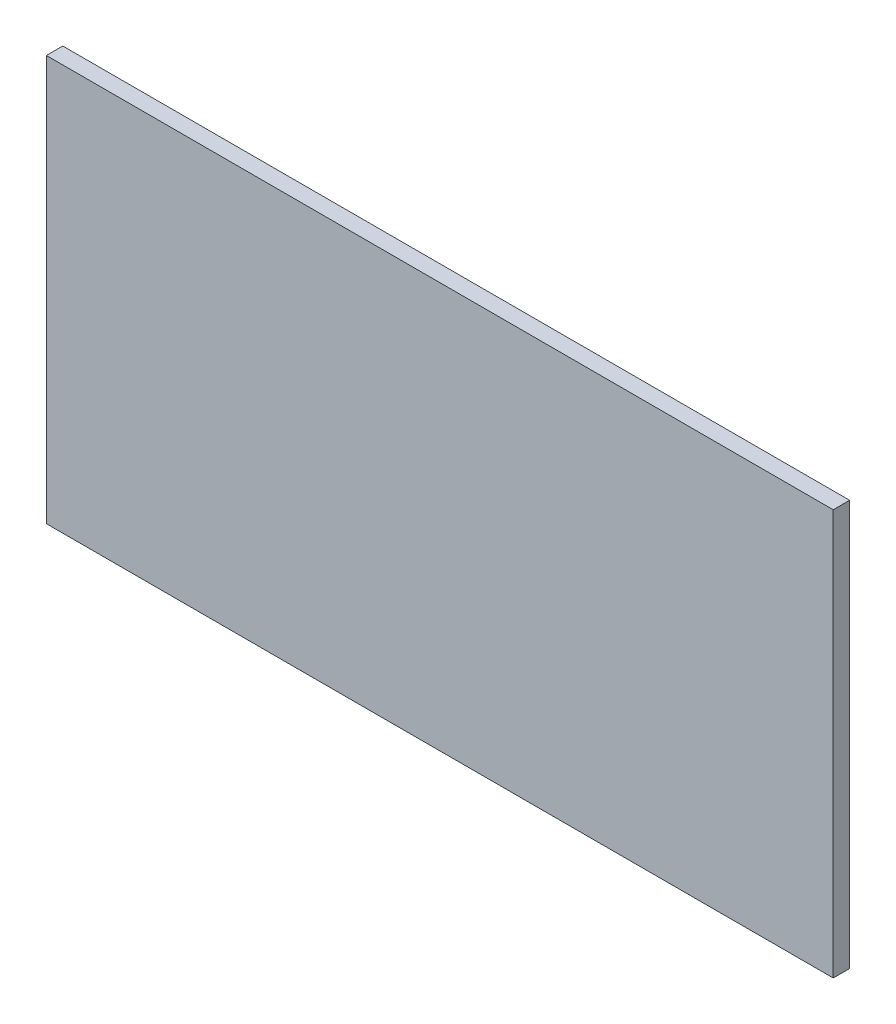
from build123d import *

# Parameters (mm, degrees)
SKETCH1_W           = 609.6
SKETCH1_H           = 314.180648672
BOSS_EXTRUDE1_DEPTH = 12.7


with BuildPart() as part:
    # Sketch1 → Boss-Extrude1 (new body)
    with BuildSketch(Plane.XY):
        Rectangle(SKETCH1_W, SKETCH1_H)
    extrude(amount=-BOSS_EXTRUDE1_DEPTH)

    # Loft1: read off the stored shape, not the designer's step
    # Loft1: loft between two sections, ruled curve by curve
    loft1_from = [
        Edge.make_bspline([(304.8, 157.090324336, -12.7), (304.8, 143.999463975, -12.7), (304.8, 130.908603613, -12.7), (304.8, 104.726882891, -12.7), (304.8, 91.636022529, -12.7), (304.8, 65.454301807, -12.7), (304.8, 52.363441445, -12.7), (304.8, 26.181720723, -12.7), (304.8, 13.090860361, -12.7), (304.8, -13.090860361, -12.7), (304.8, -26.181720723, -12.7), (304.8, -52.363441445, -12.7), (304.8, -65.454301807, -12.7), (304.8, -91.636022529, -12.7), (304.8, -104.726882891, -12.7), (304.8, -130.908603613, -12.7), (304.8, -143.999463975, -12.7), (304.8, -157.090324336, -12.7)], [0, 0, 0, 0, 0.125, 0.125, 0.25, 0.25, 0.375, 0.375, 0.5, 0.5, 0.625, 0.625, 0.75, 0.75, 0.875, 0.875, 1, 1, 1, 1], 3),
        Edge.make_bspline([(304.8, -157.090324336, -12.7), (292.1, -157.090324336, -12.7), (279.4, -157.090324336, -12.7), (254, -157.090324336, -12.7), (241.3, -157.090324336, -12.7), (215.9, -157.090324336, -12.7), (203.2, -157.090324336, -12.7), (177.8, -157.090324336, -12.7), (165.1, -157.090324336, -12.7), (139.7, -157.090324336, -12.7), (127, -157.090324336, -12.7), (101.6, -157.090324336, -12.7), (88.9, -157.090324336, -12.7), (63.5, -157.090324336, -12.7), (50.8, -157.090324336, -12.7), (25.4, -157.090324336, -12.7), (12.7, -157.090324336, -12.7), (-12.7, -157.090324336, -12.7), (-25.4, -157.090324336, -12.7), (-50.8, -157.090324336, -12.7), (-63.5, -157.090324336, -12.7), (-88.9, -157.090324336, -12.7), (-101.6, -157.090324336, -12.7), (-127, -157.090324336, -12.7), (-139.7, -157.090324336, -12.7), (-165.1, -157.090324336, -12.7), (-177.8, -157.090324336, -12.7), (-203.2, -157.090324336, -12.7), (-215.9, -157.090324336, -12.7), (-241.3, -157.090324336, -12.7), (-254, -157.090324336, -12.7), (-279.4, -157.090324336, -12.7), (-292.1, -157.090324336, -12.7), (-304.8, -157.090324336, -12.7)], [0, 0, 0, 0, 0.0625, 0.0625, 0.125, 0.125, 0.1875, 0.1875, 0.25, 0.25, 0.3125, 0.3125, 0.375, 0.375, 0.4375, 0.4375, 0.5, 0.5, 0.5625, 0.5625, 0.625, 0.625, 0.6875, 0.6875, 0.75, 0.75, 0.8125, 0.8125, 0.875, 0.875, 0.9375, 0.9375, 1, 1, 1, 1], 3),
        Edge.make_bspline([(-304.8, 157.090324336, -12.7), (-292.1, 157.090324336, -12.7), (-279.4, 157.090324336, -12.7), (-254, 157.090324336, -12.7), (-241.3, 157.090324336, -12.7), (-215.9, 157.090324336, -12.7), (-203.2, 157.090324336, -12.7), (-177.8, 157.090324336, -12.7), (-165.1, 157.090324336, -12.7), (-139.7, 157.090324336, -12.7), (-127, 157.090324336, -12.7), (-101.6, 157.090324336, -12.7), (-88.9, 157.090324336, -12.7), (-63.5, 157.090324336, -12.7), (-50.8, 157.090324336, -12.7), (-25.4, 157.090324336, -12.7), (-12.7, 157.090324336, -12.7), (12.7, 157.090324336, -12.7), (25.4, 157.090324336, -12.7), (50.8, 157.090324336, -12.7), (63.5, 157.090324336, -12.7), (88.9, 157.090324336, -12.7), (101.6, 157.090324336, -12.7), (127, 157.090324336, -12.7), (139.7, 157.090324336, -12.7), (165.1, 157.090324336, -12.7), (177.8, 157.090324336, -12.7), (203.2, 157.090324336, -12.7), (215.9, 157.090324336, -12.7), (241.3, 157.090324336, -12.7), (254, 157.090324336, -12.7), (279.4, 157.090324336, -12.7), (292.1, 157.090324336, -12.7), (304.8, 157.090324336, -12.7)], [0, 0, 0, 0, 0.0625, 0.0625, 0.125, 0.125, 0.1875, 0.1875, 0.25, 0.25, 0.3125, 0.3125, 0.375, 0.375, 0.4375, 0.4375, 0.5, 0.5, 0.5625, 0.5625, 0.625, 0.625, 0.6875, 0.6875, 0.75, 0.75, 0.8125, 0.8125, 0.875, 0.875, 0.9375, 0.9375, 1, 1, 1, 1], 3),
        Edge.make_bspline([(-304.8, -157.090324336, -12.7), (-304.8, -143.999463975, -12.7), (-304.8, -130.908603613, -12.7), (-304.8, -104.726882891, -12.7), (-304.8, -91.636022529, -12.7), (-304.8, -65.454301807, -12.7), (-304.8, -52.363441445, -12.7), (-304.8, -26.181720723, -12.7), (-304.8, -13.090860361, -12.7), (-304.8, 13.090860361, -12.7), (-304.8, 26.181720723, -12.7), (-304.8, 52.363441445, -12.7), (-304.8, 65.454301807, -12.7), (-304.8, 91.636022529, -12.7), (-304.8, 104.726882891, -12.7), (-304.8, 130.908603613, -12.7), (-304.8, 143.999463975, -12.7), (-304.8, 157.090324336, -12.7)], [0, 0, 0, 0, 0.125, 0.125, 0.25, 0.25, 0.375, 0.375, 0.5, 0.5, 0.625, 0.625, 0.75, 0.75, 0.875, 0.875, 1, 1, 1, 1], 3),
    ]
    loft1_to = [
        Edge.make_bspline([(79.022222222, 40.727121124, -38.1), (80.577057613, 37.710297337, -38.1), (81.980389053, 34.561909453, -38.1), (84.430287104, 28.050604162, -38.1), (85.476699573, 24.687769705, -38.1), (87.169677239, 17.810095816, -38.1), (87.816120347, 14.295394928, -38.1), (88.681315551, 7.187042588, -38.1), (88.9, 3.593569511, -38.1), (88.9, -3.593569511, -38.1), (88.681315551, -7.187042588, -38.1), (87.816120347, -14.295394928, -38.1), (87.169677239, -17.810095816, -38.1), (85.476699573, -24.687769705, -38.1), (84.430287104, -28.050604162, -38.1), (81.980389053, -34.561909453, -38.1), (80.577057613, -37.710297337, -38.1), (79.022222222, -40.727121124, -38.1)], [0, 0, 0, 0, 0.125, 0.125, 0.25, 0.25, 0.375, 0.375, 0.5, 0.5, 0.625, 0.625, 0.75, 0.75, 0.875, 0.875, 1, 1, 1, 1], 3),
        Edge.make_bspline([(79.022222222, -40.727121124, -38.1), (77.513810329, -43.653870095, -38.1), (75.79123489, -46.596780367, -38.1), (71.874617054, -52.43672997, -38.1), (69.680294943, -55.333709982, -38.1), (64.792903277, -60.983954027, -38.1), (62.099546472, -63.737031565, -38.1), (56.211815103, -68.985467365, -38.1), (53.017211054, -71.480494923, -38.1), (46.157754062, -76.090390736, -38.1), (42.492809932, -78.204805568, -38.1), (34.761608604, -81.934492597, -38.1), (30.695467957, -83.549260467, -38.1), (22.268836934, -86.178823265, -38.1), (17.908694381, -87.193176196, -38.1), (9.032113746, -88.553894498, -38.1), (4.516207395, -88.9, -38.1), (-4.516207395, -88.9, -38.1), (-9.032113746, -88.553894498, -38.1), (-17.908694381, -87.193176196, -38.1), (-22.268836934, -86.178823265, -38.1), (-30.695467957, -83.549260467, -38.1), (-34.761608604, -81.934492597, -38.1), (-42.492809932, -78.204805568, -38.1), (-46.157754062, -76.090390736, -38.1), (-53.017211054, -71.480494923, -38.1), (-56.211815103, -68.985467365, -38.1), (-62.099546472, -63.737031565, -38.1), (-64.792903277, -60.983954027, -38.1), (-69.680294943, -55.333709982, -38.1), (-71.874617054, -52.43672997, -38.1), (-75.79123489, -46.596780367, -38.1), (-77.513810329, -43.653870095, -38.1), (-79.022222222, -40.727121124, -38.1)], [0, 0, 0, 0, 0.0625, 0.0625, 0.125, 0.125, 0.1875, 0.1875, 0.25, 0.25, 0.3125, 0.3125, 0.375, 0.375, 0.4375, 0.4375, 0.5, 0.5, 0.5625, 0.5625, 0.625, 0.625, 0.6875, 0.6875, 0.75, 0.75, 0.8125, 0.8125, 0.875, 0.875, 0.9375, 0.9375, 1, 1, 1, 1], 3),
        Edge.make_bspline([(-79.022222222, 40.727121124, -38.1), (-77.513810329, 43.653870095, -38.1), (-75.79123489, 46.596780367, -38.1), (-71.874617054, 52.43672997, -38.1), (-69.680294943, 55.333709982, -38.1), (-64.792903277, 60.983954027, -38.1), (-62.099546472, 63.737031565, -38.1), (-56.211815103, 68.985467365, -38.1), (-53.017211054, 71.480494923, -38.1), (-46.157754062, 76.090390736, -38.1), (-42.492809932, 78.204805568, -38.1), (-34.761608604, 81.934492597, -38.1), (-30.695467957, 83.549260467, -38.1), (-22.268836934, 86.178823265, -38.1), (-17.908694381, 87.193176196, -38.1), (-9.032113746, 88.553894498, -38.1), (-4.516207395, 88.9, -38.1), (4.516207395, 88.9, -38.1), (9.032113746, 88.553894498, -38.1), (17.908694381, 87.193176196, -38.1), (22.268836934, 86.178823265, -38.1), (30.695467957, 83.549260467, -38.1), (34.761608604, 81.934492597, -38.1), (42.492809932, 78.204805568, -38.1), (46.157754062, 76.090390736, -38.1), (53.017211054, 71.480494923, -38.1), (56.211815103, 68.985467365, -38.1), (62.099546472, 63.737031565, -38.1), (64.792903277, 60.983954027, -38.1), (69.680294943, 55.333709982, -38.1), (71.874617054, 52.43672997, -38.1), (75.79123489, 46.596780367, -38.1), (77.513810329, 43.653870095, -38.1), (79.022222222, 40.727121124, -38.1)], [0, 0, 0, 0, 0.0625, 0.0625, 0.125, 0.125, 0.1875, 0.1875, 0.25, 0.25, 0.3125, 0.3125, 0.375, 0.375, 0.4375, 0.4375, 0.5, 0.5, 0.5625, 0.5625, 0.625, 0.625, 0.6875, 0.6875, 0.75, 0.75, 0.8125, 0.8125, 0.875, 0.875, 0.9375, 0.9375, 1, 1, 1, 1], 3),
        Edge.make_bspline([(-79.022222222, -40.727121124, -38.1), (-80.577057613, -37.710297337, -38.1), (-81.980389053, -34.561909453, -38.1), (-84.430287104, -28.050604162, -38.1), (-85.476699573, -24.687769705, -38.1), (-87.169677239, -17.810095816, -38.1), (-87.816120347, -14.295394928, -38.1), (-88.681315551, -7.187042588, -38.1), (-88.9, -3.593569511, -38.1), (-88.9, 3.593569511, -38.1), (-88.681315551, 7.187042588, -38.1), (-87.816120347, 14.295394928, -38.1), (-87.169677239, 17.810095816, -38.1), (-85.476699573, 24.687769705, -38.1), (-84.430287104, 28.050604162, -38.1), (-81.980389053, 34.561909453, -38.1), (-80.577057613, 37.710297337, -38.1), (-79.022222222, 40.727121124, -38.1)], [0, 0, 0, 0, 0.125, 0.125, 0.25, 0.25, 0.375, 0.375, 0.5, 0.5, 0.625, 0.625, 0.75, 0.75, 0.875, 0.875, 1, 1, 1, 1], 3),
    ]
    loft1 = Solid(Shell([*[Face.make_surface_from_curves(loft1_from[k], loft1_to[k]) for k in range(4)], Face(Wire(loft1_from)), Face(Wire(loft1_to))]))
    add(loft1)


solid = part.part
